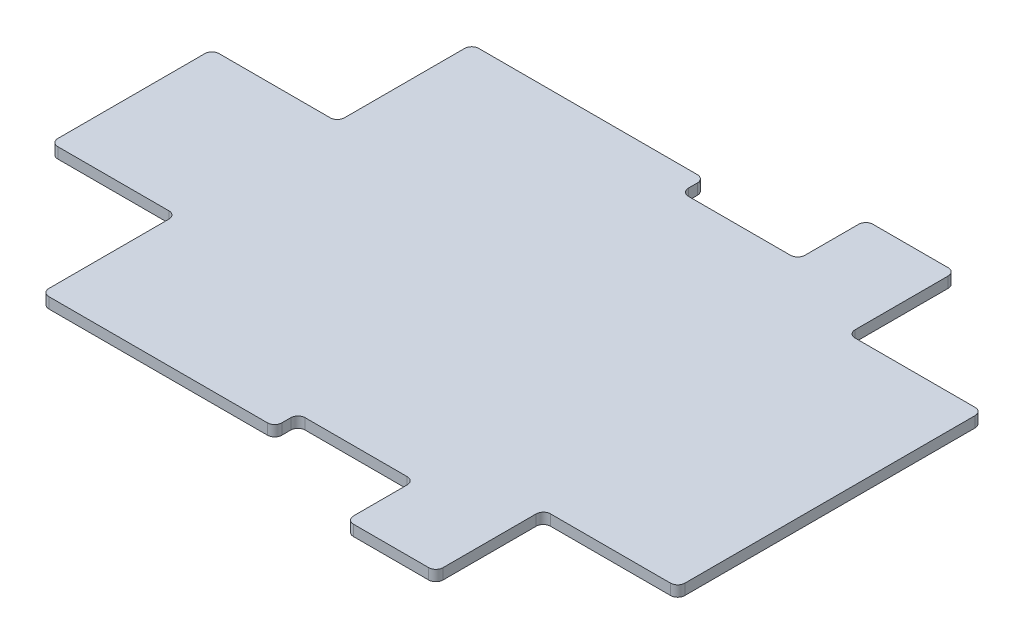
from build123d import *

# Parameters (mm, degrees)
SALIENTE_EXTRUIR1_DEPTH = 6
REDONDEO1_R             = 4


with BuildPart() as part:
    # Croquis1 → Saliente-Extruir1 (new body)
    with BuildSketch(Plane(origin=(0, 0, 0), x_dir=(1, 0, 0), z_dir=(0, 1, 0))):
        Polygon((0, 0), (-390, 0), (-390, 45), (-320, 45), (-320, 120), (-190, 120), (-190, 107), (-125, 107), (-125, 145), (-75, 145), (-75, 85), (0, 85), align=None)
    saliente_extruir1 = extrude(amount=SALIENTE_EXTRUIR1_DEPTH)

    # Simetría1: Saliente-Extruir1 across plane
    add(saliente_extruir1.mirror(Plane(origin=(0, 6, 0), x_dir=(1, 0, 0), z_dir=(0, 0, -1))))

    # Redondeo1
    redondeo1_edges = [part.edges().sort_by_distance(p)[0] for p in [
        (-390, 3, -45),
        (-320, 3, -45),
        (-320, 3, -120),
        (-190, 3, -120),
        (-190, 3, -107),
        (-125, 3, -107),
        (-125, 3, -145),
        (-75, 3, -85),
        (-75, 3, -145),
        (0, 3, -85),
        (0, 3, 85),
        (-75, 3, 85),
        (-75, 3, 145),
        (-125, 3, 145),
        (-125, 3, 107),
        (-190, 3, 107),
        (-190, 3, 120),
        (-320, 3, 120),
        (-320, 3, 45),
        (-390, 3, 45),
    ]]
    fillet(redondeo1_edges, radius=REDONDEO1_R)


solid = part.part
